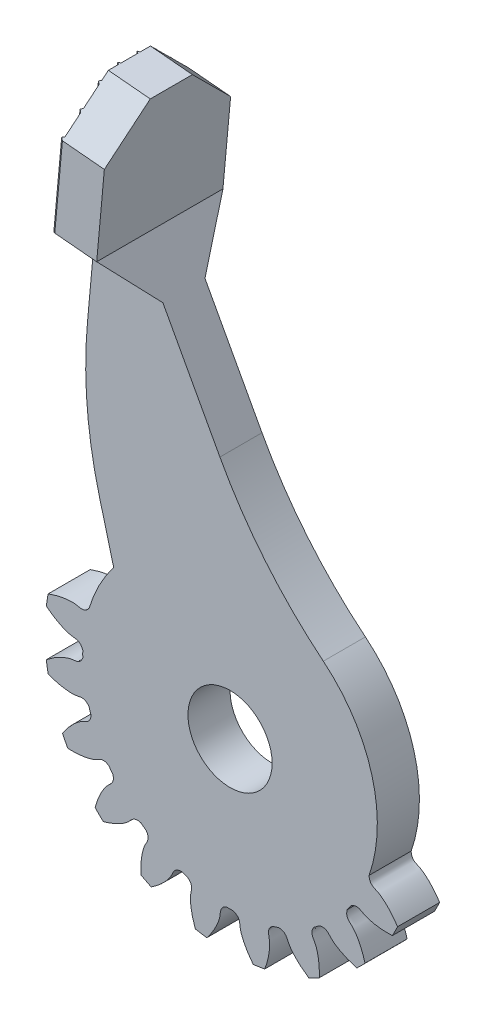
from build123d import *
from build123d.topology import SkipClean

# Parameters (mm, degrees)
SKETCH_1_R               = 22
EXTRUDE_1_DEPTH          = 30
CUT_EXTRUDE_1_DEPTH      = 44.22036557
PATTERN_CIRCULAR_1_COUNT = 20
SKETCH_4_R               = 42.426020528
CUT_EXTRUDE_2_DEPTH      = 25
SKETCH_5_R               = 5
CUT_EXTRUDE_3_DEPTH      = 30
CUT_EXTRUDE_4_DEPTH      = 32.270043673
CUT_EXTRUDE_4_DEPTH_BACK = 32.270043673
EXTRUDE_START            = -5
EXTRUDE_2_DEPTH          = 5
EXTRUDE_3_DEPTH          = 5
EXTRUDE_4_DEPTH          = 7.5
CHAMFER_1_SIZE           = 5
FILLET_1_R               = 50
FILLET_2_R               = 50
CHAMFER_2_SIZE           = 5
EXTRUDE_5_DEPTH          = 30
SKETCH_12_OUTSIDE_W      = 35.896
SKETCH_12_OUTSIDE_H      = 107.769
SKETCH_12_OUTSIDE_W_2    = 32.86016088
SKETCH_12_OUTSIDE_H_2    = 37.346189669
CUT_EXTRUDE_6_DEPTH      = 13


with BuildPart() as part:
    # 草图1 → 凸台-拉伸1 (new body)
    with BuildSketch(Plane.XY):
        Circle(SKETCH_1_R)
    extrude(amount=EXTRUDE_1_DEPTH)

    # 草图2 → 切除-拉伸1 (cut, through all)
    with BuildSketch(Plane.XY):
        with BuildLine():
            ThreePointArc((0.386633201, 17.495728472), (0, 17.5), (-0.386633201, 17.495728472))
            add(Edge.make_bspline(
                [(-0.386633201, 17.495728472), (-1.22237881, 17.786951024), (-1.114168199, 18.374227398), (-1.225794113, 18.940018805), (-1.237784373, 18.995113228), (-1.25262178, 19.05726923), (-1.270584194, 19.126393672), (-1.29195828, 19.202382994), (-1.31702411, 19.285125656), (-1.346059743, 19.374501466), (-1.3793395, 19.470381894), (-1.4171342, 19.57263009), (-1.459710797, 19.681101001), (-1.507332204, 19.795641461), (-1.560257063, 19.916090303), (-1.618739529, 20.042278463), (-1.683029067, 20.174029102), (-1.753370234, 20.311157723), (-1.830002477, 20.4534723), (-1.913159931, 20.600773408), (-2.003071219, 20.752854362), (-2.099959252, 20.909501356), (-2.204041043, 21.070493611), (-2.315527511, 21.235603527), (-2.434623302, 21.404596841), (-2.561526601, 21.577232781), (-2.696428961, 21.753264241), (-2.839515123, 21.932437945), (-2.990962853, 22.114494623), (-3.15094277, 22.299169189), (-3.319618193, 22.486190926), (-3.497144978, 22.67528367), (-3.683671369, 22.866166005), (-3.879337852, 23.058551454), (-4.084277013, 23.252148679), (-4.298613397, 23.446661685), (-4.522463379, 23.641790022), (-4.755935037, 23.837228999), (-4.999128023, 24.032669892), (-5.252133469, 24.227800163), (-5.515033799, 24.42230368), (-5.882947182, 24.683279735), (-6.167864825, 24.872665202), (-6.362315964, 24.996503719)],
                knots=[0, 0, 0, 0, 0.165916003, 0.170905922, 0.176663519, 0.183188797, 0.190481754, 0.198542391, 0.207370708, 0.216966704, 0.22733038, 0.238461736, 0.250360771, 0.263027487, 0.276461881, 0.290663956, 0.30563371, 0.321371144, 0.337876258, 0.355149051, 0.373189524, 0.391997677, 0.411573509, 0.431917021, 0.453028213, 0.474907084, 0.497553636, 0.520967867, 0.545149777, 0.570099367, 0.595816637, 0.622301587, 0.649554216, 0.677574526, 0.706362514, 0.735918183, 0.766241531, 0.797332559, 0.829191267, 0.861817654, 0.895211721, 0.929373468, 1, 1, 1, 1], degree=3))
            ThreePointArc((-6.362315964, 24.996503719), (0, 25.793492641), (6.362315964, 24.996503719))
            add(Edge.make_bspline(
                [(0.386633201, 17.495728472), (1.22237881, 17.786951024), (1.114168199, 18.374227398), (1.225794113, 18.940018805), (1.237784373, 18.995113228), (1.25262178, 19.05726923), (1.270584194, 19.126393672), (1.29195828, 19.202382994), (1.31702411, 19.285125656), (1.346059743, 19.374501466), (1.3793395, 19.470381894), (1.4171342, 19.57263009), (1.459710797, 19.681101001), (1.507332204, 19.795641461), (1.560257063, 19.916090303), (1.618739529, 20.042278463), (1.683029067, 20.174029102), (1.753370234, 20.311157723), (1.830002477, 20.4534723), (1.913159931, 20.600773408), (2.003071219, 20.752854362), (2.099959252, 20.909501356), (2.204041043, 21.070493611), (2.315527511, 21.235603527), (2.434623302, 21.404596841), (2.561526601, 21.577232781), (2.696428961, 21.753264241), (2.839515123, 21.932437945), (2.990962853, 22.114494623), (3.15094277, 22.299169189), (3.319618193, 22.486190926), (3.497144978, 22.67528367), (3.683671369, 22.866166005), (3.879337852, 23.058551454), (4.084277013, 23.252148679), (4.298613397, 23.446661685), (4.522463379, 23.641790022), (4.755935037, 23.837228999), (4.999128023, 24.032669892), (5.252133469, 24.227800163), (5.515033799, 24.42230368), (5.882947182, 24.683279735), (6.167864825, 24.872665202), (6.362315964, 24.996503719)],
                knots=[0, 0, 0, 0, 0.165916003, 0.170905922, 0.176663519, 0.183188797, 0.190481754, 0.198542391, 0.207370708, 0.216966704, 0.22733038, 0.238461736, 0.250360771, 0.263027487, 0.276461881, 0.290663956, 0.30563371, 0.321371144, 0.337876258, 0.355149051, 0.373189524, 0.391997677, 0.411573509, 0.431917021, 0.453028213, 0.474907084, 0.497553636, 0.520967867, 0.545149777, 0.570099367, 0.595816637, 0.622301587, 0.649554216, 0.677574526, 0.706362514, 0.735918183, 0.766241531, 0.797332559, 0.829191267, 0.861817654, 0.895211721, 0.929373468, 1, 1, 1, 1], degree=3))
        make_face()
    cut_extrude_1 = extrude(amount=CUT_EXTRUDE_1_DEPTH, mode=Mode.SUBTRACT)

    # 阵列(圆周)1: 切除-拉伸1 ×20 about axis
    pattern_circular_1_axis = Axis((0, 0, 30), (0, 0, -1))
    for i in range(1, PATTERN_CIRCULAR_1_COUNT):
        add(cut_extrude_1.rotate(pattern_circular_1_axis, i * 360 / PATTERN_CIRCULAR_1_COUNT), mode=Mode.SUBTRACT)

    # 草图4 → 切除-拉伸2 (cut)
    with BuildSketch(Plane.XY.offset(30)):
        Circle(SKETCH_4_R)
    extrude(amount=-CUT_EXTRUDE_2_DEPTH, mode=Mode.SUBTRACT)

    # 草图5 → 切除-拉伸3 (cut)
    with BuildSketch(Plane.XY.offset(5)):
        Circle(SKETCH_5_R)
    extrude(amount=-CUT_EXTRUDE_3_DEPTH, mode=Mode.SUBTRACT)

    # 草图6 → 切除-拉伸4 (cut, two sides: drawn at the far end of the back side and taken through both)
    with SkipClean():  # the faces are left unmerged after this step: merging them gives an invalid solid
        with BuildSketch(Plane.XY.offset(5).offset(-CUT_EXTRUDE_4_DEPTH_BACK)):
            with BuildLine():
                Line((-20.758490142, 6.744842311), (-16.643489035, 5.407797402))
                ThreePointArc((-16.643489035, 5.407797402), (5.407797402, 16.643489035), (16.643489035, -5.407797402))
                Line((16.643489035, -5.407797402), (21.719213192, -7.057000153))
                ThreePointArc((21.719213192, -7.057000153), (7.057000153, 21.719213192), (-21.719213192, 7.057000153))
                Line((-21.719213192, 7.057000153), (-20.758490142, 6.744842311))
            make_face()
        extrude(amount=CUT_EXTRUDE_4_DEPTH + CUT_EXTRUDE_4_DEPTH_BACK, mode=Mode.SUBTRACT)

    # 草图8 → 凸台-拉伸2 (add)
    with SkipClean():  # the faces are left unmerged after this step: merging them gives an invalid solid
        with BuildSketch(Plane.XY.offset(5).offset(EXTRUDE_START)):
            with BuildLine():
                Line((-16.833866538, 35.558317016), (-17.743917137, 25.599812715))
                Line((-17.743917137, 25.599812715), (-13.361694142, 11.661004478))
                Line((-13.361694142, 11.661004478), (-13.244564028, 11.438160854))
                ThreePointArc((-13.244564028, 11.438160854), (-10.425655605, 14.055451085), (-7.103032173, 15.993652927))
                Line((-7.103032173, 15.993652927), (-7.116923948, 16.150677901))
                Line((-7.116923948, 16.150677901), (-14.756365846, 25.326797535))
                Line((-14.756365846, 25.326797535), (-13.846315248, 35.285301836))
                Line((-13.846315248, 35.285301836), (-16.833866538, 35.558317016))
            make_face()
            with BuildLine():
                ThreePointArc((-7.103032173, 15.993652927), (-10.425655605, 14.055451085), (-13.244564028, 11.438160854))
                Line((-13.244564028, 11.438160854), (-9.845586414, 4.971502025))
                Line((-9.845586414, 4.971502025), (-6.06629526, 4.274949566))
                Line((-6.06629526, 4.274949566), (-7.103032173, 15.993652927))
            make_face()
        extrude(amount=EXTRUDE_2_DEPTH)

    # 草图9 → 凸台-拉伸3 (add)
    with BuildSketch(Plane.XY.offset(5)):
        Polygon((-17.743917137, 25.599812715), (-14.45670501, 61.571127002), (-9.47745286, 61.116101702), (-10.842528758, 46.178345251), (14.937756451, -1.365075898), (8.589233605, -3.031537573), (5.696669418, 9.242315872), (-9.070112028, 10.35516536), (-11.26190143, 1.029160587), align=None)
    extrude(amount=-EXTRUDE_3_DEPTH)

    # 草图10 → 凸台-拉伸4 (add, symmetric)
    with BuildSketch(Plane(origin=(0, 0, 2.5), x_dir=(-1, 0, 0), z_dir=(0, 0, -1))):
        Polygon((14.45670501, 61.571127002), (9.47745286, 61.116101702), (10.842528758, 46.178345251), (15.821780908, 46.63337055), align=None)
    extrude(amount=EXTRUDE_4_DEPTH, both=True)

    # 倒角1
    chamfer_1_edges = [part.edges().sort_by_distance(p)[0] for p in [
        (-13.332154833, 46.405857901, 0),
        (-13.332154833, 46.405857901, 5),
    ]]
    chamfer(chamfer_1_edges, length=CHAMFER_1_SIZE - 0.0001)  # a hair under: the kernel refuses the full size

    # 圆角1
    fillet_1_edges = [part.edges().sort_by_distance(p)[0] for p in [
        (5.124125331, 16.733001512, 2.5),
    ]]
    fillet(fillet_1_edges, radius=FILLET_1_R)

    # 圆角2
    fillet_2_edges = [part.edges().sort_by_distance(p)[0] for p in [
        (-17.743917137, 25.599812715, 2.5),
    ]]
    fillet(fillet_2_edges, radius=FILLET_2_R)

    # 倒角2
    chamfer_2_edges = [part.edges().sort_by_distance(p)[0] for p in [
        (-11.967078935, 61.343614352, 10),
        (-11.967078935, 61.343614352, -5),
    ]]
    chamfer(chamfer_2_edges, length=CHAMFER_2_SIZE)

    # 草图11 → 凸台-拉伸5 (add)
    with SkipClean():  # the faces are left unmerged after this step: merging them gives an invalid solid
        with BuildSketch(Plane(origin=(5.460303591, 59.751025805, 0), x_dir=(0.9958504300755238, -0.09100505985050747, 0), z_dir=(0.09100505985050747, 0.9958504300755238, 0))):
            Polygon((-20, 5), (-20, 4.711324865), (-20.25, 4.855662433), align=None)
            Polygon((-20, 3), (-20, 2.711324865), (-20.25, 2.855662433), align=None)
            Polygon((-20, 1), (-20, 0.711324865), (-20.25, 0.855662433), align=None)
            Polygon((-20, -1.211324865), (-20, -1.5), (-20.25, -1.355662433), align=None)
            Polygon((-20, -3.5), (-20, -3.788675135), (-20.25, -3.644337567), align=None)
            Polygon((-20, -7.711324865), (-20, -8), (-20.25, -7.855662433), align=None)
            Polygon((-20, -9.711324865), (-20, -10), (-20.25, -9.855662433), align=None)
            Polygon((-20, -5.711324865), (-20, -6), (-20.25, -5.855662433), align=None)
        extrude(amount=-EXTRUDE_5_DEPTH)

    # 草图12 outside → 切除-拉伸6 (cut)
    with SkipClean():  # the faces are left unmerged after this step: merging them gives an invalid solid
        with BuildSketch(Plane(origin=(-19.917008602, 1.820101197, 0), x_dir=(0, 0, 1), z_dir=(-0.9958504300755237, 0.09100505985050783, 0))):
            with Locations((2.5, 19.7135)):
                Rectangle(SKETCH_12_OUTSIDE_W, SKETCH_12_OUTSIDE_H)
            Polygon((0, 60), (-5, 55), (-5, 45), (0, 40), (5, 40), (10, 45), (10, 55), (5, 60), align=None, mode=Mode.SUBTRACT)
            with Locations((0.537362405, -2.267847328)):
                Rectangle(SKETCH_12_OUTSIDE_W_2, SKETCH_12_OUTSIDE_H_2, mode=Mode.SUBTRACT)
        extrude(amount=CUT_EXTRUDE_6_DEPTH, mode=Mode.SUBTRACT)


solid = part.part
